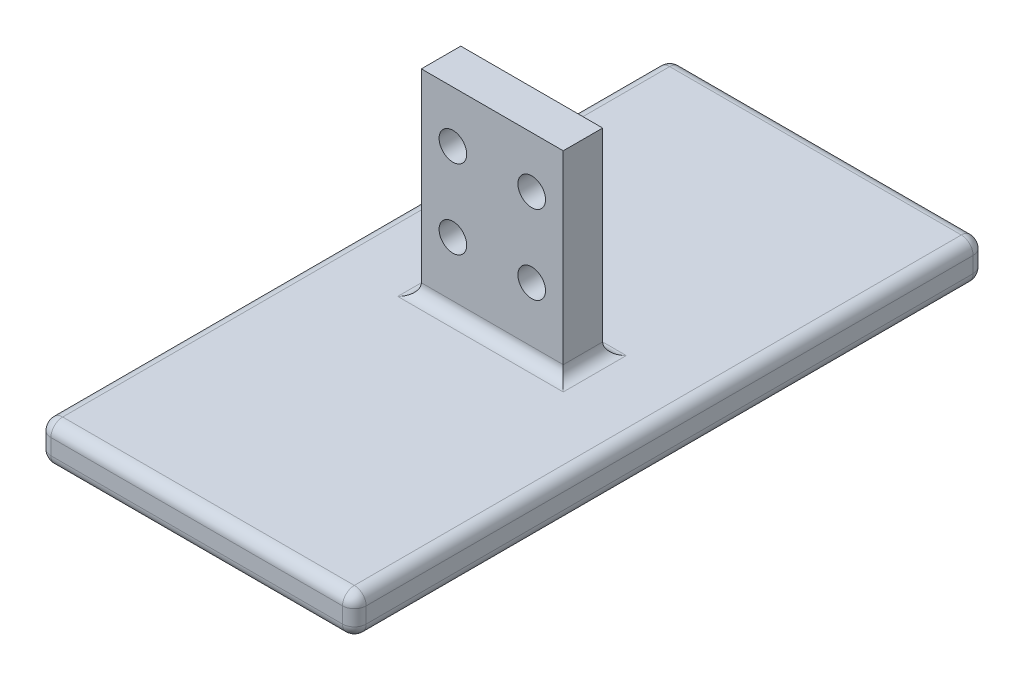
from build123d import *

# Parameters (mm, degrees)
BOSS_EXTRUDE1_DEPTH      = 40
BOSS_EXTRUDE1_DEPTH_BACK = 40
SKETCH1_W                = 40
SKETCH1_H                = 5
BOSS_EXTRUDE2_DEPTH      = 2.5
BOSS_EXTRUDE2_DEPTH_BACK = 2.5
SKETCH2_W                = 18
SKETCH2_H                = 25
SKETCH2_R                = 1.75
FILLET1_R                = 1.5
FILLET2_R                = 1.5
FILLET3_R                = 1.5


with BuildPart() as part:
    # Sketch1 → Boss-Extrude1 (new, two sides: drawn at the far end of the back side and taken through both)
    with BuildSketch(Plane.XY.offset(-BOSS_EXTRUDE1_DEPTH_BACK)):
        Rectangle(SKETCH1_W, SKETCH1_H)
    extrude(amount=BOSS_EXTRUDE1_DEPTH + BOSS_EXTRUDE1_DEPTH_BACK)

    # Sketch2 → Boss-Extrude2 (add, two sides: drawn at the far end of the back side and taken through both)
    with BuildSketch(Plane.XY.offset(-BOSS_EXTRUDE2_DEPTH_BACK)):
        with Locations((0, 15)):
            Rectangle(SKETCH2_W, SKETCH2_H)
        with Locations((-5, 11)):
            Circle(SKETCH2_R, mode=Mode.SUBTRACT)
        with Locations((5, 11)):
            Circle(SKETCH2_R, mode=Mode.SUBTRACT)
        with Locations((5, 21)):
            Circle(SKETCH2_R, mode=Mode.SUBTRACT)
        with Locations((-5, 21)):
            Circle(SKETCH2_R, mode=Mode.SUBTRACT)
    extrude(amount=BOSS_EXTRUDE2_DEPTH + BOSS_EXTRUDE2_DEPTH_BACK)

    # Fillet1
    fillet1_edges = [part.edges().sort_by_distance(p)[0] for p in [
        (0, 2.5, 40),
        (0, -2.5, 40),
        (0, -2.5, -40),
        (9, 2.5, 0),
        (0, 2.5, -2.5),
        (-9, 2.5, 0),
        (0, 2.5, 2.5),
        (20, -2.5, 0),
        (-20, -2.5, 0),
        (-20, 2.5, 0),
        (20, 2.5, 0),
        (0, 2.5, -40),
    ]]
    fillet(fillet1_edges, radius=FILLET1_R)

    # Fillet2
    # the kernel refuses this fillet: 1.5 mm, written as the material it takes off along each edge
    with BuildSketch(Plane(origin=(18.5, 1, 38.5), x_dir=(1, 0, 0), z_dir=(0, 0, 1))) as fillet2_piece_1_section:
        Polygon((0, 0), (FILLET2_R, 0), (FILLET2_R, FILLET2_R), (0, FILLET2_R), align=None)
    fillet2_piece_1 = extrude(amount=FILLET2_R, mode=Mode.PRIVATE)
    fillet2_piece_1 = fillet2_piece_1 - Plane(origin=(18.5, 1, 38.5), x_dir=(-0.7071067811865475, -0.7071067811865475, 0), z_dir=(0, 0, 1)) * Sphere(FILLET2_R, mode=Mode.PRIVATE)
    add(fillet2_piece_1, mode=Mode.SUBTRACT)
    with BuildSketch(Plane(origin=(-18.5, 1, 38.5), x_dir=(-1, 0, 0), z_dir=(0, 0, 1))) as fillet2_piece_2_section:
        Polygon((0, 0), (FILLET2_R, 0), (FILLET2_R, -FILLET2_R), (0, -FILLET2_R), align=None)
    fillet2_piece_2 = extrude(amount=FILLET2_R, mode=Mode.PRIVATE)
    fillet2_piece_2 = fillet2_piece_2 - Plane(origin=(-18.5, 1, 38.5), x_dir=(0.7071067811865475, -0.7071067811865475, 0), z_dir=(0, 0, 1)) * Sphere(FILLET2_R, mode=Mode.PRIVATE)
    add(fillet2_piece_2, mode=Mode.SUBTRACT)
    with BuildSketch(Plane(origin=(-18.5, -1, 38.5), x_dir=(-1, 0, 0), z_dir=(0, 0, 1))) as fillet2_piece_3_section:
        Polygon((0, 0), (FILLET2_R, 0), (FILLET2_R, FILLET2_R), (0, FILLET2_R), align=None)
    fillet2_piece_3 = extrude(amount=FILLET2_R, mode=Mode.PRIVATE)
    fillet2_piece_3 = fillet2_piece_3 - Plane(origin=(-18.5, -1, 38.5), x_dir=(0.7071067811865475, 0.7071067811865475, 0), z_dir=(0, 0, 1)) * Sphere(FILLET2_R, mode=Mode.PRIVATE)
    add(fillet2_piece_3, mode=Mode.SUBTRACT)
    with BuildSketch(Plane(origin=(18.5, -1, 38.5), x_dir=(1, 0, 0), z_dir=(0, 0, 1))) as fillet2_piece_4_section:
        Polygon((0, 0), (FILLET2_R, 0), (FILLET2_R, -FILLET2_R), (0, -FILLET2_R), align=None)
    fillet2_piece_4 = extrude(amount=FILLET2_R, mode=Mode.PRIVATE)
    fillet2_piece_4 = fillet2_piece_4 - Plane(origin=(18.5, -1, 38.5), x_dir=(-0.7071067811865475, 0.7071067811865475, 0), z_dir=(0, 0, 1)) * Sphere(FILLET2_R, mode=Mode.PRIVATE)
    add(fillet2_piece_4, mode=Mode.SUBTRACT)
    with BuildSketch(Plane(origin=(20, 1, 40), x_dir=(-1, 0, 0), z_dir=(0, -1, 0)), Plane(origin=(-20, -1, 40), x_dir=(1, 0, 0), z_dir=(0, 1, 0))) as fillet2_piece_5:
        with BuildLine():
            CenterArc((FILLET2_R, FILLET2_R), FILLET2_R, 180, 90)
            Line((0, FILLET2_R), (0, 0))
            Line((0, 0), (FILLET2_R, 0))
        make_face()
    extrude(amount=2, mode=Mode.SUBTRACT)

    # Fillet3
    # the kernel refuses this fillet: 1.5 mm, written as the material it takes off along each edge
    with BuildSketch(Plane(origin=(18.5, 1, -38.5), x_dir=(0, 0, -1), z_dir=(1, 0, 0))) as fillet3_piece_1_section:
        Polygon((0, 0), (FILLET3_R, 0), (FILLET3_R, FILLET3_R), (0, FILLET3_R), align=None)
    fillet3_piece_1 = extrude(amount=FILLET3_R, mode=Mode.PRIVATE)
    fillet3_piece_1 = fillet3_piece_1 - Plane(origin=(18.5, 1, -38.5), x_dir=(0, -0.7071067811865475, 0.7071067811865475), z_dir=(1, 0, 0)) * Sphere(FILLET3_R, mode=Mode.PRIVATE)
    add(fillet3_piece_1, mode=Mode.SUBTRACT)
    with BuildSketch(Plane(origin=(-18.5, 1, -38.5), x_dir=(0, 0, -1), z_dir=(-1, 0, 0))) as fillet3_piece_2_section:
        Polygon((0, 0), (FILLET3_R, 0), (FILLET3_R, -FILLET3_R), (0, -FILLET3_R), align=None)
    fillet3_piece_2 = extrude(amount=FILLET3_R, mode=Mode.PRIVATE)
    fillet3_piece_2 = fillet3_piece_2 - Plane(origin=(-18.5, 1, -38.5), x_dir=(0, -0.7071067811865475, 0.7071067811865475), z_dir=(-1, 0, 0)) * Sphere(FILLET3_R, mode=Mode.PRIVATE)
    add(fillet3_piece_2, mode=Mode.SUBTRACT)
    with BuildSketch(Plane(origin=(-18.5, -1, -38.5), x_dir=(0, 0, -1), z_dir=(-1, 0, 0))) as fillet3_piece_3_section:
        Polygon((0, 0), (FILLET3_R, 0), (FILLET3_R, FILLET3_R), (0, FILLET3_R), align=None)
    fillet3_piece_3 = extrude(amount=FILLET3_R, mode=Mode.PRIVATE)
    fillet3_piece_3 = fillet3_piece_3 - Plane(origin=(-18.5, -1, -38.5), x_dir=(0, 0.7071067811865475, 0.7071067811865475), z_dir=(-1, 0, 0)) * Sphere(FILLET3_R, mode=Mode.PRIVATE)
    add(fillet3_piece_3, mode=Mode.SUBTRACT)
    with BuildSketch(Plane(origin=(18.5, -1, -38.5), x_dir=(0, 0, -1), z_dir=(1, 0, 0))) as fillet3_piece_4_section:
        Polygon((0, 0), (FILLET3_R, 0), (FILLET3_R, -FILLET3_R), (0, -FILLET3_R), align=None)
    fillet3_piece_4 = extrude(amount=FILLET3_R, mode=Mode.PRIVATE)
    fillet3_piece_4 = fillet3_piece_4 - Plane(origin=(18.5, -1, -38.5), x_dir=(0, 0.7071067811865475, 0.7071067811865475), z_dir=(1, 0, 0)) * Sphere(FILLET3_R, mode=Mode.PRIVATE)
    add(fillet3_piece_4, mode=Mode.SUBTRACT)
    with BuildSketch(Plane(origin=(20, 1, -40), x_dir=(0, 0, 1), z_dir=(0, -1, 0)), Plane(origin=(-20, -1, -40), x_dir=(0, 0, 1), z_dir=(0, 1, 0))) as fillet3_piece_5:
        with BuildLine():
            CenterArc((FILLET3_R, FILLET3_R), FILLET3_R, 180, 90)
            Line((0, FILLET3_R), (0, 0))
            Line((0, 0), (FILLET3_R, 0))
        make_face()
    extrude(amount=2, mode=Mode.SUBTRACT)


solid = part.part
